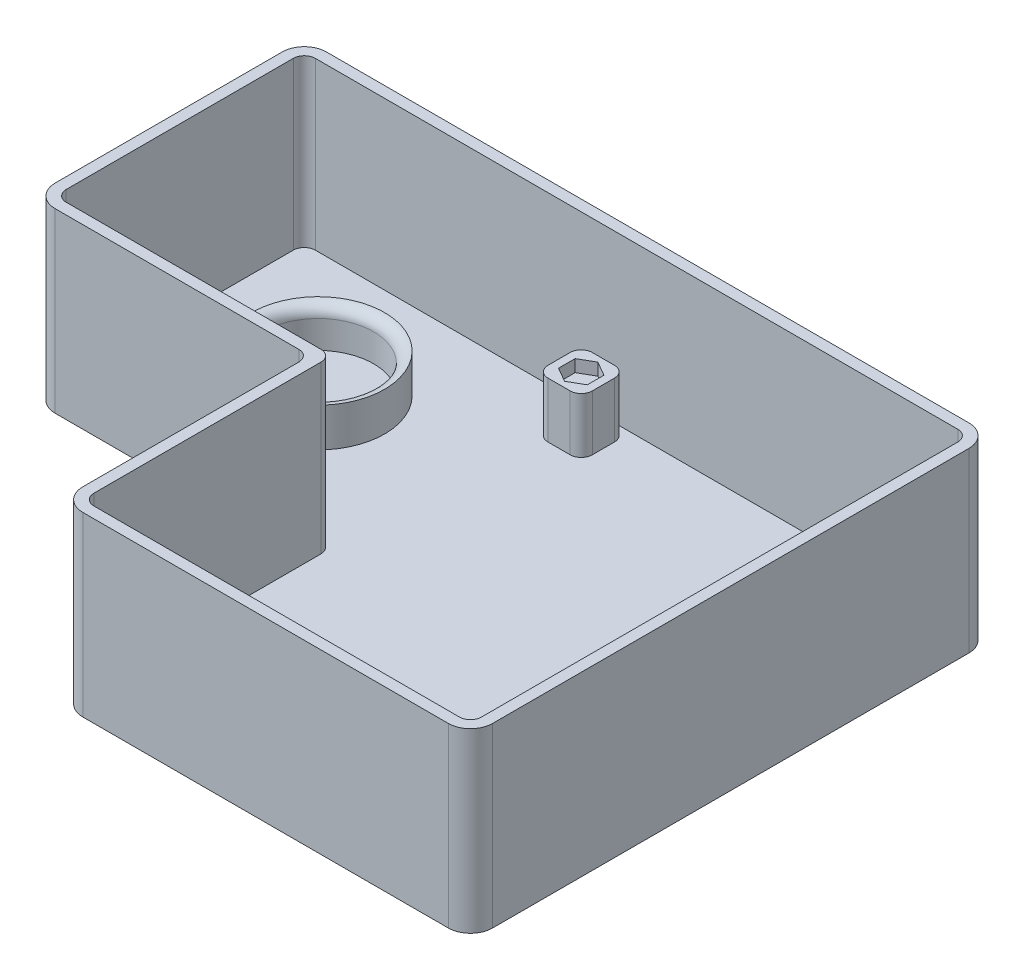
from build123d import *

# Parameters (mm, degrees)
BOSS_EXTRUDE1_DEPTH = 30
BOSS_EXTRUDE2_DEPTH = 2
SKETCH5_R           = 12
SKETCH5_R_2         = 10
BOSS_EXTRUDE3_DEPTH = 7
SKETCH6_W           = 8
SKETCH6_H           = 8
BOSS_EXTRUDE4_DEPTH = 10
CUT_EXTRUDE1_START  = 10
CUT_EXTRUDE1_DEPTH  = 2.2
FILLET1_R           = 2
SKETCH8_W           = 10
SKETCH8_H           = 10
CUT_EXTRUDE3_DEPTH  = 122.128031438


with BuildPart() as part:
    # Sketch2 → Boss-Extrude1 (new body)
    with BuildSketch(Plane(origin=(0, 0, 0), x_dir=(1, 0, 0), z_dir=(0, 1, 0))):
        with BuildLine():
            Line((72, 2), (72, 88))
            ThreePointArc((72, 88), (70.828427125, 90.828427125), (68, 92))
            Line((68, 92), (-48, 92))
            ThreePointArc((-48, 92), (-50.828427125, 90.828427125), (-52, 88))
            Line((-52, 88), (-52, 47))
            ThreePointArc((-52, 47), (-50.828427125, 44.171572875), (-48, 43))
            Line((-48, 43), (-2, 43))
            Line((-2, 43), (-2, 2))
            ThreePointArc((-2, 2), (-0.828427125, -0.828427125), (2, -2))
            Line((2, -2), (68, -2))
            ThreePointArc((68, -2), (70.828427125, -0.828427125), (72, 2))
        make_face()
        with BuildLine():
            Line((70, 2), (70, 88))
            ThreePointArc((70, 88), (69.414213562, 89.414213562), (68, 90))
            Line((68, 90), (-48, 90))
            ThreePointArc((-48, 90), (-49.414213562, 89.414213562), (-50, 88))
            Line((-50, 88), (-50, 47))
            ThreePointArc((-50, 47), (-49.414213562, 45.585786438), (-48, 45))
            Line((-48, 45), (-2, 45))
            ThreePointArc((-2, 45), (-0.585786438, 44.414213562), (0, 43))
            Line((0, 43), (0, 2))
            ThreePointArc((0, 2), (0.585786438, 0.585786438), (2, 0))
            Line((2, 0), (68, 0))
            ThreePointArc((68, 0), (69.414213562, 0.585786438), (70, 2))
        make_face(mode=Mode.SUBTRACT)
    extrude(amount=BOSS_EXTRUDE1_DEPTH)



with BuildPart() as body_2:
    # Sketch3 → Boss-Extrude2 (new body)
    # profile 1 of 2: a face of its own
    with BuildSketch(Plane(origin=(0, 0, 0), x_dir=(1, 0, 0), z_dir=(0, 1, 0))):
        with BuildLine():
            Line((-48, 92), (68, 92))
            ThreePointArc((68, 92), (70.828427125, 90.828427125), (72, 88))
            Line((72, 88), (72, 2))
            ThreePointArc((72, 2), (70.828427125, -0.828427125), (68, -2))
            Line((68, -2), (2, -2))
            ThreePointArc((2, -2), (-0.828427125, -0.828427125), (-2, 2))
            Line((-2, 2), (-2, 43))
            Line((-2, 43), (-48, 43))
            ThreePointArc((-48, 43), (-50.828427125, 44.171572875), (-52, 47))
            Line((-52, 47), (-52, 88))
            ThreePointArc((-52, 88), (-50.828427125, 90.828427125), (-48, 92))
        make_face()
        with BuildLine():
            Line((0, 43), (0, 2))
            ThreePointArc((0, 2), (0.585786438, 0.585786438), (2, 0))
            Line((2, 0), (68, 0))
            ThreePointArc((68, 0), (69.414213562, 0.585786438), (70, 2))
            Line((70, 2), (70, 88))
            ThreePointArc((70, 88), (69.414213562, 89.414213562), (68, 90))
            Line((68, 90), (-48, 90))
            ThreePointArc((-48, 90), (-49.414213562, 89.414213562), (-50, 88))
            Line((-50, 88), (-50, 47))
            ThreePointArc((-50, 47), (-49.414213562, 45.585786438), (-48, 45))
            Line((-48, 45), (-2, 45))
            ThreePointArc((-2, 45), (-0.585786438, 44.414213562), (0, 43))
        make_face(mode=Mode.SUBTRACT)
    # profile 2 of 2: a face of its own
    with BuildSketch(Plane(origin=(0, 0, 0), x_dir=(1, 0, 0), z_dir=(0, 1, 0))):
        with BuildLine():
            ThreePointArc((0, 43), (-0.585786438, 44.414213562), (-2, 45))
            Line((-2, 45), (-48, 45))
            ThreePointArc((-48, 45), (-49.414213562, 45.585786438), (-50, 47))
            Line((-50, 47), (-50, 88))
            ThreePointArc((-50, 88), (-49.414213562, 89.414213562), (-48, 90))
            Line((-48, 90), (68, 90))
            ThreePointArc((68, 90), (69.414213562, 89.414213562), (70, 88))
            Line((70, 88), (70, 2))
            ThreePointArc((70, 2), (69.414213562, 0.585786438), (68, 0))
            Line((68, 0), (2, 0))
            ThreePointArc((2, 0), (0.585786438, 0.585786438), (0, 2))
            Line((0, 2), (0, 43))
        make_face()
    extrude(amount=-BOSS_EXTRUDE2_DEPTH)


with BuildPart() as part_1:
    add(part.part)

    add(body_2.part)  # Boss-Extrude3 merges body 2
    # Sketch5 → Boss-Extrude3 (add)
    with BuildSketch(Plane(origin=(0, 0, 0), x_dir=(1, 0, 0), z_dir=(0, 1, 0))):
        with Locations(Location((-25, 67.5, 0), (0, 0, 270))):
            Circle(SKETCH5_R)
        with Locations(Location((-25, 67.5, 0), (0, 0, 270))):
            Circle(SKETCH5_R_2, mode=Mode.SUBTRACT)
    extrude(amount=BOSS_EXTRUDE3_DEPTH)

    # Sketch6 → Boss-Extrude4 (add)
    with BuildSketch(Plane(origin=(0, 0, 0), x_dir=(1, 0, 0), z_dir=(0, 1, 0))):
        with Locations((65, 85)):
            Rectangle(SKETCH6_W, SKETCH6_H)
        Polygon((60.857142857, 8), (68.857142857, 8), (68.857142857, 2), (67.357142857, 0.5), (60.857142857, 0.5), align=None)
        Polygon((9.142857143, 0.5), (9.142857143, 8), (1.142857143, 8), (1.142857143, 2), (2.642857143, 0.5), align=None)
        with Locations((5, 85)):
            Rectangle(SKETCH6_W, SKETCH6_H)
    extrude(amount=BOSS_EXTRUDE4_DEPTH)

    # Sketch7 → Cut-Extrude1 (cut)
    with BuildSketch(Plane(origin=(0, 0, 0), x_dir=(1, 0, 0), z_dir=(0, 1, 0)).offset(CUT_EXTRUDE1_START)):
        Polygon((2.4, 86.5011107), (2.4, 83.4988893), (5, 81.9977786), (7.6, 83.4988893), (7.6, 86.5011107), (5, 88.0022214), align=None)
        Polygon((2.4, 5.643967843), (2.4, 2.641746443), (5, 1.140635743), (7.6, 2.641746443), (7.6, 5.643967843), (5, 7.145078543), align=None)
        Polygon((65, 1.140635743), (62.4, 2.641746443), (62.4, 5.643967843), (65, 7.145078543), (67.6, 5.643967843), (67.6, 2.641746443), align=None)
        Polygon((62.4, 86.5011107), (65, 88.0022214), (67.6, 86.5011107), (67.6, 83.4988893), (65, 81.9977786), (62.4, 83.4988893), align=None)
    extrude(amount=-CUT_EXTRUDE1_DEPTH, mode=Mode.SUBTRACT)

    # Fillet1
    fillet1_edges = [part_1.edges().sort_by_distance(p)[0] for p in [
        (61, 5, -89),
        (61, 5, -81),
        (69, 5, -81),
        (69, 5, -89),
        (60.857142857, 5, -8),
        (60.857142857, 5, -0.5),
        (68.857142857, 5, -8),
        (9.142857143, 5, -8),
        (1.142857143, 5, -8),
        (9.142857143, 5, -0.5),
        (9, 5, -81),
        (9, 5, -89),
        (1, 5, -89),
        (1, 5, -81),
        (-2, 14, -43),
        (-25, 7, -77.5),
    ]]
    fillet(fillet1_edges, radius=FILLET1_R - 0.0001)  # a hair under: the kernel refuses the full size

    # Sketch8 → Cut-Extrude3 (cut, through all)
    with BuildSketch(Plane.XZ.offset(2)):
        with Locations((35, -7)):
            Rectangle(SKETCH8_W, SKETCH8_H)
    extrude(amount=-CUT_EXTRUDE3_DEPTH, mode=Mode.SUBTRACT)


solid = part_1.part
